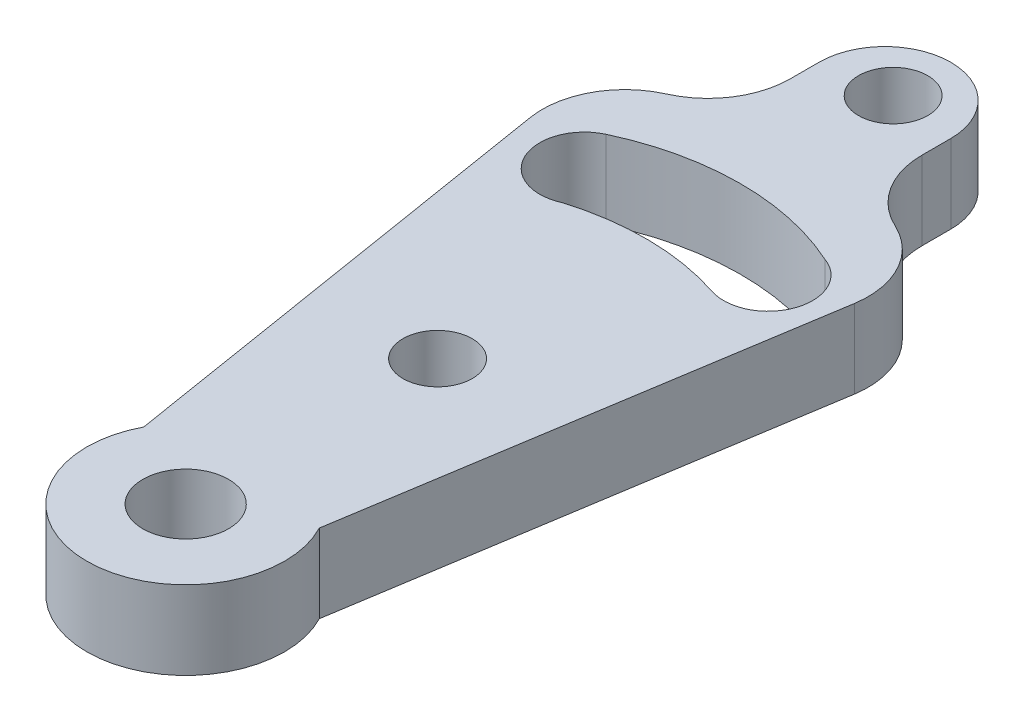
from build123d import *

# Parameters (mm, degrees)
BASE_FLANGE1_DEPTH         = 4.7625
CUT_EXTRUDE1_DEPTH         = 532.464280138
F_5_2_5_2_DIAMETER_HOLE1_D = 5.2
F_4_2_4_2_DIAMETER_HOLE1_D = 4.2


# Sheet-metal steps are written as plain solids
with BuildPart() as part:
    # Sketch11 → Base-Flange1 (new body)
    with BuildSketch(Plane.XZ.offset(-2274.861409739)):
        with BuildLine():
            Line((-14.848279171, -526.663757324), (-14.848279171, -524.922409256))
            ThreePointArc((-14.848279171, -524.922409256), (-14.061019769, -522.229303864), (-11.947152511, -520.384267488))
            ThreePointArc((-11.947152511, -520.384267488), (-9.635257269, -518.200933677), (-9.1073955, -515.065145404))
            Line((-9.1073955, -515.065145404), (-13.536920305, -487.054470663))
            ThreePointArc((-13.536920305, -487.054470663), (-18.839332617, -478.263515672), (-24.167937573, -487.038618817))
            Line((-24.167937573, -487.038618817), (-28.703176429, -515.010971128))
            ThreePointArc((-28.703176429, -515.010971128), (-28.167792512, -518.185746554), (-25.8079527, -520.375949969))
            ThreePointArc((-25.8079527, -520.375949969), (-23.652946505, -522.220569615), (-22.848279171, -524.940713697))
            Line((-22.848279171, -524.940713697), (-22.848279171, -526.663757324))
            ThreePointArc((-22.848279171, -526.663757324), (-18.848279171, -530.663757324), (-14.848279171, -526.663757324))
        make_face()
    extrude(amount=-BASE_FLANGE1_DEPTH)

    # Sketch16 → Cut-Extrude1 (cut, through all)
    with BuildSketch(Plane(origin=(0, 2279.623909739, 0), x_dir=(-1, 0, 0), z_dir=(0, 1, 0))):
        with BuildLine():
            ThreePointArc((23.232934356, -511.51957962), (18.659918541, -512.162345688), (14.104175105, -511.406816996))
            ThreePointArc((14.104175105, -511.406816996), (10.671023737, -513.070256662), (12.334463403, -516.50340803))
            ThreePointArc((12.334463403, -516.50340803), (18.94176187, -517.91323157), (25.531859334, -516.425074701))
            ThreePointArc((25.531859334, -516.425074701), (26.835144386, -512.822864672), (23.232934356, -511.51957962))
        make_face()
    extrude(amount=-CUT_EXTRUDE1_DEPTH, mode=Mode.SUBTRACT)

    # Ø5.2 (5.2) Diameter Hole1 (through all)
    with Locations(Plane(origin=(0, 2279.623909739, 0), x_dir=(1, 0, 0), z_dir=(0, 1, 0))):
        with Locations((-18.848279171, 484.263509002)):
            Hole(F_5_2_5_2_DIAMETER_HOLE1_D / 2)

    # Ø4.2 (4.2) Diameter Hole1 (through all)
    with Locations(Plane(origin=(0, 2279.623909739, 0), x_dir=(1, 0, 0), z_dir=(0, 1, 0))):
        with Locations((-18.848279171, 499.538509002), (-18.848279171, 527.163757324)):
            Hole(F_4_2_4_2_DIAMETER_HOLE1_D / 2)


solid = part.part
